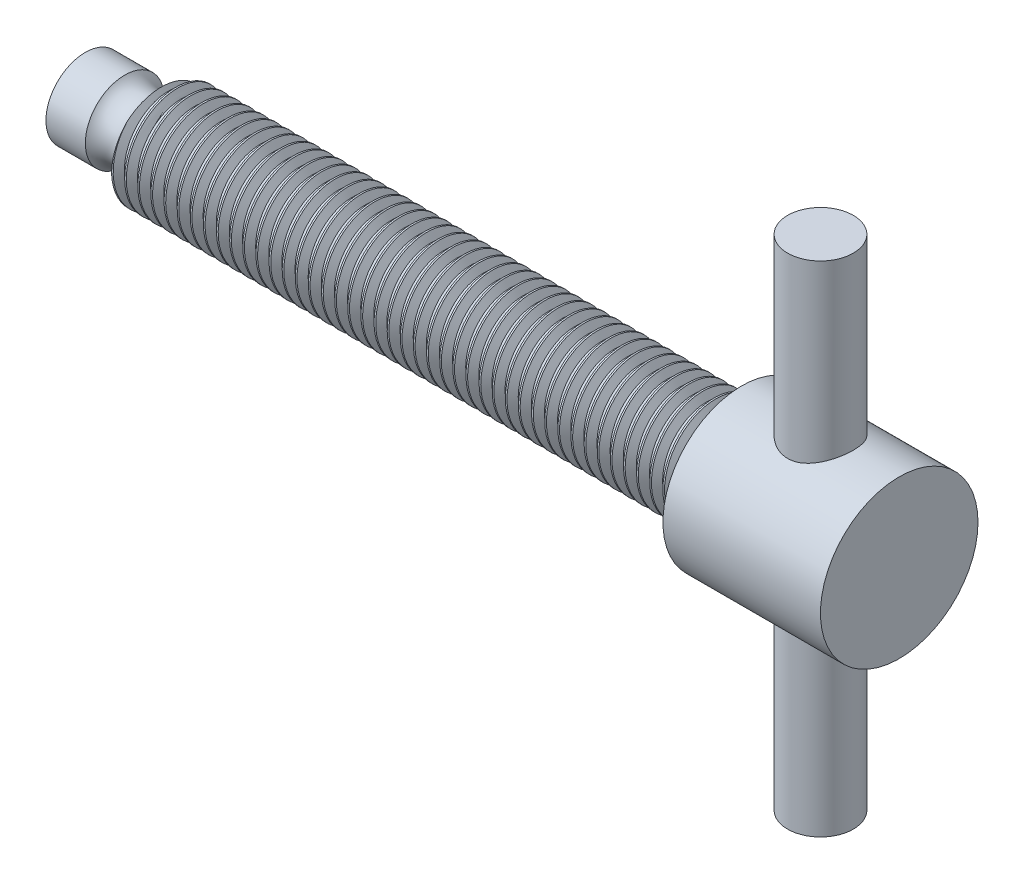
from build123d import *

# Parameters (mm, degrees)
SKETCH2_W     = 2.5
SKETCH2_H     = 19
THREAD1_PITCH = 1
THREAD1_FROM  = 1


with BuildPart() as part:
    # Sketch1 → Revolve1 (revolve)
    with BuildSketch(Plane(origin=(0, 0, 0), x_dir=(1, 0, 0), z_dir=(0, 1, 0))):
        with BuildLine():
            Line((-12, 4), (-56, 4))
            ThreePointArc((-56, 4), (-57.13962039, 2.41886117), (-59, 3))
            Line((-59, 3), (-62, 3))
            Line((-62, 3), (-62, 0))
            Line((-62, 0), (0, 0))
            Line((0, 0), (0, 6))
            Line((0, 6), (-12, 6))
            Line((-12, 6), (-12, 4))
        make_face()
    revolve(axis=Axis((73.252495702, 0, 0), (-1, 0, 0)))

    # Sketch2 → Revolve2 (revolve)
    with BuildSketch(Plane.XY, mode=Mode.PRIVATE) as revolve2_sk:
        with Locations((-7.25, -9.5)):
            Rectangle(SKETCH2_W, SKETCH2_H)
        with Locations((-7.25, 9.5)):
            Rectangle(SKETCH2_W, SKETCH2_H)
    revolve(revolve2_sk.sketch.rotate(Axis((-6, -19, 0), (0, 1, 0)), 180), axis=Axis((-6, -19, 0), (0, 1, 0)))

    # Thread1: arcs per turn and ends read off the stored shape
    # Thread1: the profile of Thread Profile1 profile screwed along a right-hand helix through 46 turns, 8 arcs to a turn; built about Z, then put on its axis
    thread1_z = Axis((0, 0, 0), (0, 0, 1))
    thread1_corners = [(4.0003, 0, -0.000173205), (4.0003, 0, 0.875173202), (3.458734125, 0, 0.562499999), (3.458734125, 0, 0.312499999)]
    with BuildLine(mode=Mode.PRIVATE) as thread1_profile:
        Line(thread1_corners[0], thread1_corners[1])
        Line(thread1_corners[1], thread1_corners[2])
        Line(thread1_corners[2], thread1_corners[3])
        Line(thread1_corners[3], thread1_corners[0])
    thread1_cap = Face(thread1_profile.wire())
    thread1_turn_angles = [0, 22.5, 45, 67.5, 90, 112.5, 135, 157.5, 180, 202.5, 225, 247.5, 270, 292.5, 315, 337.5, 360]
    thread1_turn_weights = [1, 0.9238795325112867, 1, 0.9238795325112867, 1, 0.9238795325112867, 1, 0.9238795325112867, 1, 0.9238795325112867, 1, 0.9238795325112867, 1, 0.9238795325112867, 1, 0.9238795325112867, 1]
    thread1_turn_rails = [Edge.make_bspline([Vector(p[0], p[1], 0).rotate(thread1_z, thread1_turn_angles[k]) / thread1_turn_weights[k] + Vector(0, 0, p[2] + THREAD1_PITCH * thread1_turn_angles[k] / 360) for k in range(17)], [0, 0, 0, 1, 1, 2, 2, 3, 3, 4, 4, 5, 5, 6, 6, 7, 7, 8, 8, 8], 2, thread1_turn_weights) for p in thread1_corners]
    thread1_turn_sides = [Face.make_surface_from_curves(thread1_turn_rails[p[0]], thread1_turn_rails[p[1]]) for p in [(0, 1), (1, 2), (2, 3), (3, 0)]]
    thread1 = Plane(origin=(-11, 0, 0), x_dir=(0, 0, 1), z_dir=(-1, 0, 0)) * split(Solid(Shell([*[p.moved(Location((0, 0, THREAD1_PITCH * i))) for i in range(46) for p in thread1_turn_sides], thread1_cap, thread1_cap.rotate(thread1_z, 16560).moved(Location((0, 0, THREAD1_PITCH * 16560 / 360)))])), bisect_by=Plane.XY.offset(THREAD1_FROM), keep=Keep.TOP, mode=Mode.PRIVATE)
    add(thread1, mode=Mode.SUBTRACT)


solid = part.part
